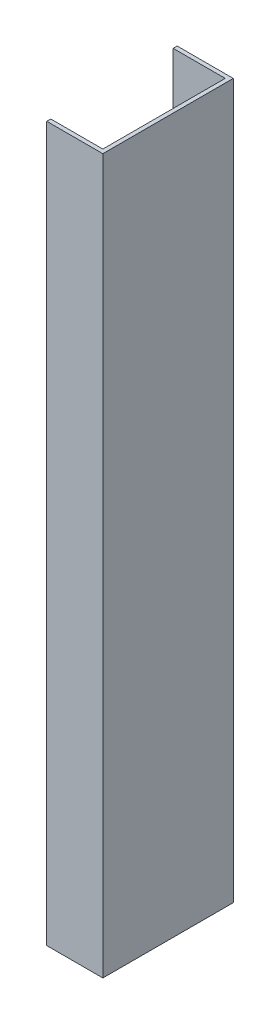
from build123d import *

# Parameters (mm, degrees)
SALIENTE_EXTRUIR1_DEPTH = 222.25


with BuildPart() as part:
    # Croquis1 → Saliente-Extruir1 (new, symmetric)
    with BuildSketch(Plane(origin=(0, 0, 0), x_dir=(1, 0, 0), z_dir=(0, 1, 0))):
        Polygon((0, 40.6), (0, -40.6), (-34.925, -40.6), (-34.925, -38.1), (-2.5, -38.1), (-2.5, 38.1), (-34.925, 38.1), (-34.925, 40.6), align=None)
    extrude(amount=SALIENTE_EXTRUIR1_DEPTH, both=True)


solid = part.part
